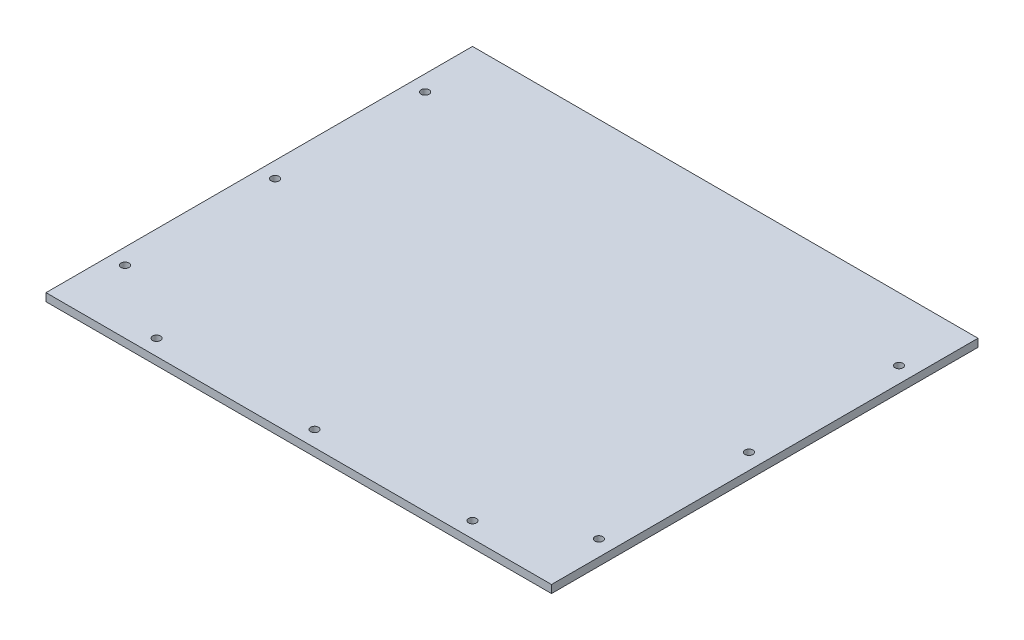
from build123d import *

# Parameters (mm, degrees)
SKETCH1_W           = 406.4
SKETCH1_H           = 342.9
BOSS_EXTRUDE1_DEPTH = 6.35
SKETCH3_R           = 3.175
CUT_EXTRUDE1_DEPTH  = 532.772218624


with BuildPart() as part:
    # Sketch1 → Boss-Extrude1 (new body)
    with BuildSketch(Plane(origin=(0, 0, 0), x_dir=(1, 0, 0), z_dir=(0, 1, 0))):
        with Locations((203.2, 171.45)):
            Rectangle(SKETCH1_W, SKETCH1_H)
    extrude(amount=BOSS_EXTRUDE1_DEPTH)

    # Sketch3 → Cut-Extrude1 (cut, through all)
    with BuildSketch(Plane(origin=(0, 6.35, 0), x_dir=(1, 0, 0), z_dir=(0, 1, 0))):
        with Locations((203.2, 12.7)):
            Circle(SKETCH3_R)
        with Locations((330.2, 12.7)):
            Circle(SKETCH3_R)
        with Locations((76.2, 12.7)):
            Circle(SKETCH3_R)
        with Locations((12.7, 171.45)):
            Circle(SKETCH3_R)
        with Locations((393.7, 171.45)):
            Circle(SKETCH3_R)
        with Locations((12.7, 292.1)):
            Circle(SKETCH3_R)
        with Locations((12.7, 50.8)):
            Circle(SKETCH3_R)
        with Locations((393.7, 50.8)):
            Circle(SKETCH3_R)
        with Locations((393.7, 292.1)):
            Circle(SKETCH3_R)
    extrude(amount=-CUT_EXTRUDE1_DEPTH, mode=Mode.SUBTRACT)


solid = part.part
